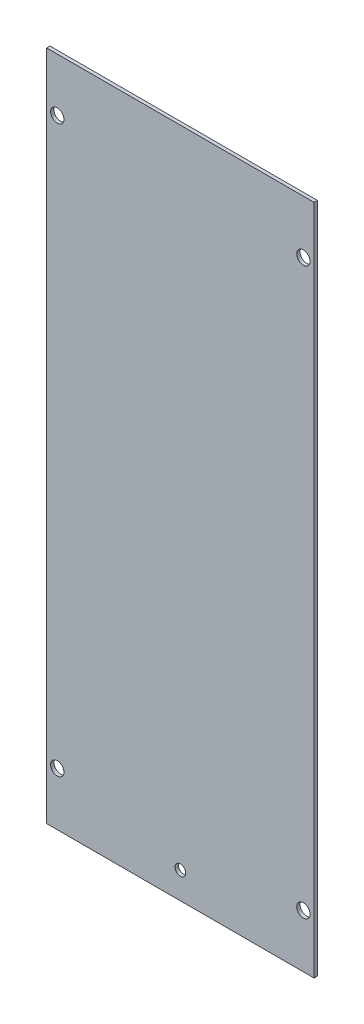
from build123d import *

# Parameters (mm, degrees)
SKETCH1_W            = 127.635
SKETCH1_H            = 320.675
MAIN_PLATE_DEPTH     = 1.5875
SKETCH2_R            = 3.175
BOLT_HOLES_DEPTH     = 6.35
LPATTERN1_COUNT      = 2
LPATTERN1_PITCH      = 117.475
LPATTERN1_COUNT_DIR2 = 2
LPATTERN1_PITCH_DIR2 = 269.875
SKETCH3_R            = 2.54
WIRE_HOLE_DEPTH      = 6.35


with BuildPart() as part:
    # Sketch1 → Main Plate (new body)
    with BuildSketch(Plane.XY):
        with Locations((63.8175, 160.3375)):
            Rectangle(SKETCH1_W, SKETCH1_H)
    extrude(amount=MAIN_PLATE_DEPTH)

    # Sketch2 → Bolt Holes (cut)
    with BuildSketch(Plane.XY.offset(1.5875)):
        with Locations((5.08, 295.275)):
            Circle(SKETCH2_R)
    bolt_holes = extrude(amount=-BOLT_HOLES_DEPTH, mode=Mode.SUBTRACT)

    # LPattern1: Bolt Holes 2 × 2
    with Locations(*[(i * LPATTERN1_PITCH, -j * LPATTERN1_PITCH_DIR2, 0) for i in range(LPATTERN1_COUNT) for j in range(LPATTERN1_COUNT_DIR2) if (i, j) != (0, 0)]):
        add(bolt_holes, mode=Mode.SUBTRACT)

    # Sketch3 → Wire Hole (cut)
    with BuildSketch(Plane.XY.offset(1.5875)):
        with Locations((63.8175, 12.7)):
            Circle(SKETCH3_R)
    extrude(amount=-WIRE_HOLE_DEPTH, mode=Mode.SUBTRACT)


solid = part.part
